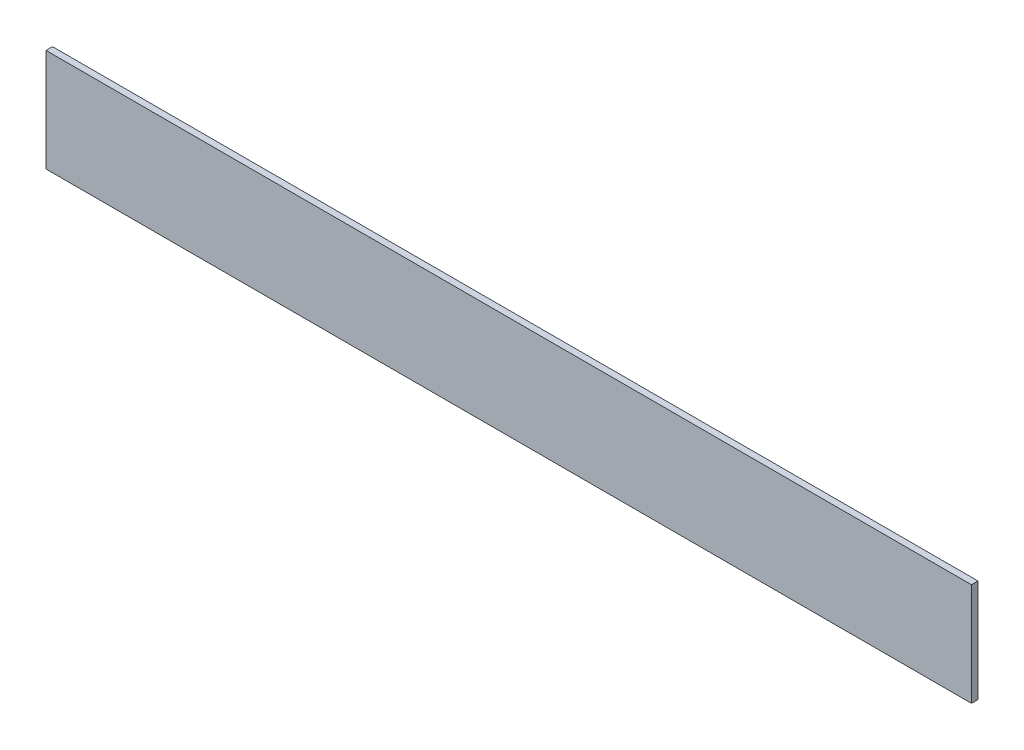
from build123d import *

# Parameters (mm, degrees)
SKETCH1_W           = 450.85
SKETCH1_H           = 50.038
BOSS_EXTRUDE1_DEPTH = 3.175


with BuildPart() as part:
    # Sketch1 → Boss-Extrude1 (new body)
    with BuildSketch(Plane.XY):
        Rectangle(SKETCH1_W, SKETCH1_H)
    extrude(amount=BOSS_EXTRUDE1_DEPTH)


solid = part.part
